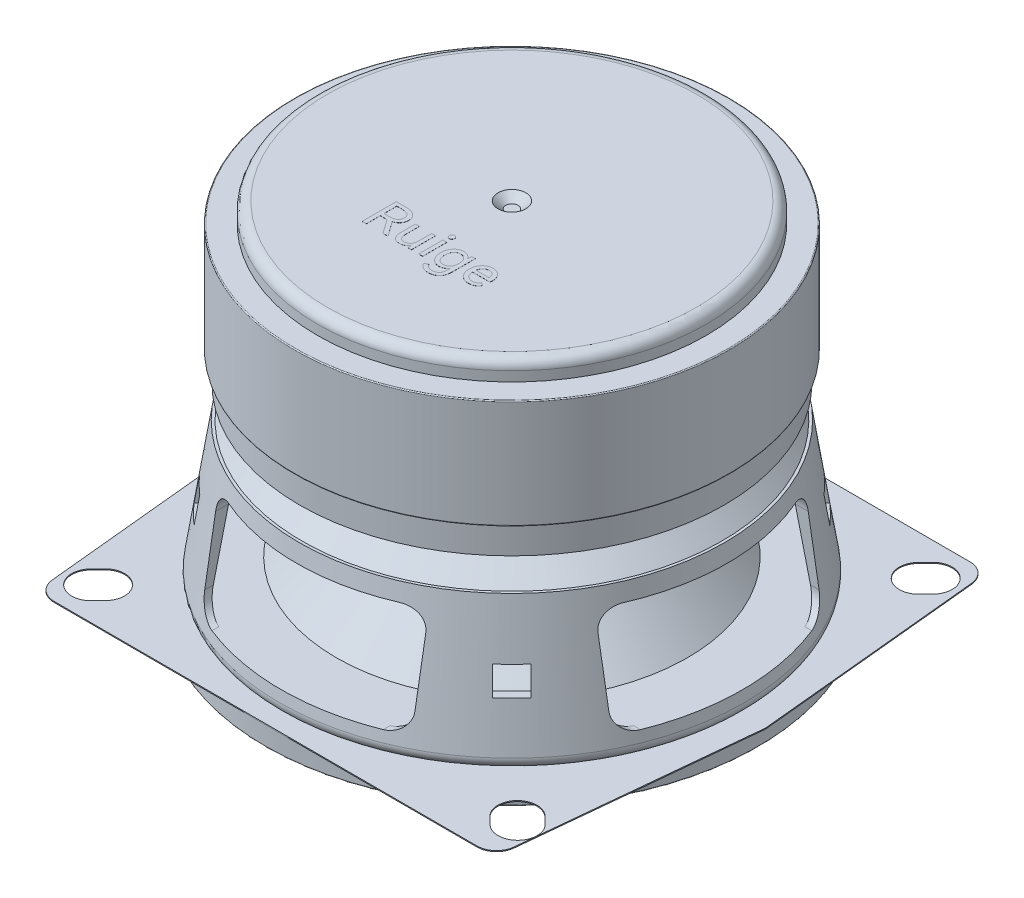
from build123d import *

# Parameters (mm, degrees)
SKETCH_2_R               = 19.925
EXTRUDE_1_DEPTH          = 2
SKETCH_3_R               = 22.3
EXTRUDE_2_DEPTH          = 11.15
SKETCH_4_R               = 21.75
EXTRUDE_3_DEPTH          = 3
SKETCH_5_R               = 18.225
EXTRUDE_4_DEPTH          = 3.3
EXTRUDE_4_DRAFT          = -45
EXTRUDE_5_DEPTH          = 0.1
SKETCH_12_R              = 25.25
EXTRUDE_7_DEPTH          = 2
FILLET_1_R               = 1
FILLET_2_R               = 0.1
FILLET_5_R               = 0.1
CUT_EXTRUDE_3_DEPTH      = 52.024708658
PATTERN_CIRCULAR_1_COUNT = 4
SKETCH_17_R              = 23
CUT_EXTRUDE_4_DEPTH      = 12.125994
CUT_EXTRUDE_4_DRAFT      = 12
EXTRUDE_9_REACH          = 50.081
SKETCH_19_R              = 17.996686734
EXTRUDE_9_DRAFT          = 45
CUT_EXTRUDE_START        = -33.9
CUT_EXTRUDE_5_DEPTH      = 33.9
PATTERN_CIRCULAR_2_COUNT = 4
SKETCH_27_R              = 24.25
CUT_EXTRUDE_6_DEPTH      = 1
SKETCH_28_R              = 17.5
CUT_EXTRUDE_7_DEPTH      = 7
CUT_EXTRUDE_7_DRAFT      = -45
FILLET_6_R               = 0.1
SKETCH_30_W              = 0.406719368
SKETCH_30_H              = 2.481126482
EXTRUDE_11_DEPTH         = 0.01
CUT_EXTRUDE_START_2      = 30
SKETCH_31_W              = 2.706391377
SKETCH_31_H              = 2.784707462
CUT_EXTRUDE_8_DEPTH      = 10
PATTERN_CIRCULAR_3_COUNT = 4
FILLET_7_R               = 1
FILLET_8_R               = 1


# Read off the part's stored shape, not the designer's step: 曲面-缝合2
with BuildPart() as part:
    # 草图2 → 凸台-拉伸1 (new body)
    with BuildSketch(Plane(origin=(0, 0, 0), x_dir=(1, 0, 0), z_dir=(0, 1, 0))):
        with Locations(Location((0, 0, 0), (0, 0, 270))):
            Circle(SKETCH_2_R)
    extrude(amount=-EXTRUDE_1_DEPTH)

    # 草图14 → 切除-旋转1 (revolve, cut)
    with BuildSketch(Plane.XY, mode=Mode.PRIVATE) as cut_revolve_1_sk:
        Polygon((0, 0), (0, -0.717703915), (0.633716951, -0.717703915), (1.426933152, 0), align=None)
    revolve(cut_revolve_1_sk.sketch.rotate(Axis((0, 0, 0), (0, -1, 0)), 270), axis=Axis((0, 0, 0), (0, -1, 0)), mode=Mode.SUBTRACT)

    # 圆角1
    fillet_1_edges = [part.edges().sort_by_distance(p)[0] for p in [
        (0, 0, -19.925),
    ]]
    fillet(fillet_1_edges, radius=FILLET_1_R)

    # 草图30 → 凸台-拉伸11 (add)
    # profile 1 of 6: a face of its own
    with BuildSketch(Plane(origin=(0, 0, 0), x_dir=(1, 0, 0), z_dir=(0, 1, 0))):
        with BuildLine():
            Line((-3.189977143, -9.508206591), (-3.711518645, -9.508206591))
            Line((-3.711518645, -9.508206591), (-4.724858565, -8.073621611))
            Line((-4.724858565, -8.073621611), (-4.767743941, -8.073621611))
            Line((-4.767743941, -8.073621611), (-5.417941569, -8.073621611))
            Line((-5.417941569, -8.073621611), (-5.417941569, -9.508206591))
            Line((-5.417941569, -9.508206591), (-5.844028526, -9.508206591))
            Line((-5.844028526, -9.508206591), (-5.844028526, -6.008206591))
            Line((-5.844028526, -6.008206591), (-4.767743941, -6.008206591))
            add(Edge.make_bspline(
                [(-4.767743941, -6.008206591), (-4.70955201, -6.009767727), (-4.595872808, -6.01281744), (-4.430543422, -6.03754974), (-4.274878485, -6.077294392), (-4.153398813, -6.125045973), (-4.062266763, -6.170555461), (-3.997880606, -6.207743839), (-3.937430612, -6.248811533), (-3.880890416, -6.293018597), (-3.827668416, -6.340105273), (-3.779572492, -6.391437805), (-3.734934017, -6.445717016), (-3.694278018, -6.503045755), (-3.65745215, -6.562864703), (-3.626314425, -6.625824059), (-3.599491507, -6.690508681), (-3.576754117, -6.75735909), (-3.560894465, -6.826554583), (-3.547739113, -6.897537495), (-3.541247241, -6.970932874), (-3.539944619, -7.020614984), (-3.539285443, -7.045755998)],
                knots=[0, 0, 0, 0, 1.934696954, 3.779472598, 5.546483382, 7.268182974, 8.108419679, 8.933114725, 9.739238456, 10.536928548, 11.31898344, 12.100135439, 12.873874383, 13.654800496, 14.436027776, 15.20767373, 15.988110199, 16.764125966, 17.552770483, 18.347062047, 19.163551324, 20, 20, 20, 20], degree=3))
            add(Edge.make_bspline(
                [(-3.539285443, -7.045755998), (-3.539680007, -7.073918297), (-3.540461879, -7.129724973), (-3.550819415, -7.211739879), (-3.565567295, -7.290971813), (-3.587440046, -7.367012503), (-3.614774665, -7.440323822), (-3.649206268, -7.51034914), (-3.688473091, -7.578160438), (-3.735148815, -7.641868893), (-3.785880629, -7.702992655), (-3.842450506, -7.758840629), (-3.902609103, -7.811458631), (-3.96869255, -7.858060435), (-4.038689009, -7.901045982), (-4.113067369, -7.94024851), (-4.192631903, -7.973880145), (-4.247926345, -7.992792934), (-4.275945522, -8.002376551)],
                knots=[0, 0, 0, 0, 1.040008213, 2.060890069, 3.050100258, 4.015617353, 4.980908869, 5.937361294, 6.895936475, 7.87251746, 8.852141338, 9.828127481, 10.806787564, 11.802179348, 12.811907597, 13.84086371, 14.905907697, 16, 16, 16, 16], degree=3))
            Line((-4.275945522, -8.002376551), (-3.189977143, -9.508206591))
        make_face()
        with BuildLine():
            Line((-5.417941569, -6.381724377), (-5.417941569, -7.700795524))
            Line((-5.417941569, -7.700795524), (-4.820313111, -7.700795524))
            add(Edge.make_bspline(
                [(-4.820313111, -7.700795524), (-4.787552491, -7.700299923), (-4.723765511, -7.699334958), (-4.631119158, -7.690854923), (-4.544248608, -7.677578243), (-4.463942606, -7.657119145), (-4.389042171, -7.632663159), (-4.320746178, -7.601218611), (-4.257550365, -7.565533731), (-4.201770653, -7.522914976), (-4.151531445, -7.476507335), (-4.10788884, -7.425948376), (-4.07061385, -7.371585591), (-4.041248766, -7.3131601), (-4.017081975, -7.251737034), (-4.000739626, -7.186414121), (-3.990914775, -7.117300749), (-3.989576217, -7.069998921), (-3.988890186, -7.045755998)],
                knots=[0, 0, 0, 0, 1.314087679, 2.558611031, 3.729626903, 4.835706093, 5.880026302, 6.885990906, 7.847505876, 8.78550528, 9.695301978, 10.587288996, 11.459633258, 12.332565881, 13.205253402, 14.102691954, 15.027600109, 16, 16, 16, 16], degree=3))
            add(Edge.make_bspline(
                [(-3.988890186, -7.045755998), (-3.989604467, -7.021747994), (-3.991011456, -6.974457131), (-4.00060358, -6.905295153), (-4.017389385, -6.839433445), (-4.040870127, -6.777275992), (-4.070847496, -6.71845892), (-4.107802343, -6.663450827), (-4.151757149, -6.612283782), (-4.201459699, -6.564368704), (-4.257761776, -6.521318388), (-4.320459669, -6.483848959), (-4.38919931, -6.452218736), (-4.463643745, -6.425698608), (-4.544288157, -6.405706511), (-4.631148696, -6.39254529), (-4.723724391, -6.382946294), (-4.787545808, -6.382138907), (-4.820313111, -6.381724377)],
                knots=[0, 0, 0, 0, 0.958943898, 1.888923538, 2.782433681, 3.668508104, 4.53761959, 5.413778369, 6.308853537, 7.227314963, 8.166777724, 9.133430475, 10.138837689, 11.184606099, 12.285843585, 13.451733503, 14.691664551, 16, 16, 16, 16], degree=3))
            Line((-4.820313111, -6.381724377), (-5.417941569, -6.381724377))
        make_face(mode=Mode.SUBTRACT)
    # profile 2 of 6: a face of its own
    with BuildSketch(Plane(origin=(0, 0, 0), x_dir=(1, 0, 0), z_dir=(0, 1, 0))):
        with BuildLine():
            Line((-1.206874376, -7.022238211), (-0.800155008, -7.022238211))
            Line((-0.800155008, -7.022238211), (-0.800155008, -9.508206591))
            Line((-0.800155008, -9.508206591), (-1.159147103, -9.508206591))
            add(Edge.make_bspline(
                [(-1.159147103, -9.508206591), (-1.160535092, -9.469228953), (-1.163197642, -9.394458963), (-1.17057106, -9.287745479), (-1.177676871, -9.191058254), (-1.184345526, -9.130292898), (-1.187506787, -9.101487223)],
                knots=[0, 0, 0, 0, 1.147570014, 2.201359651, 3.14735877, 4, 4, 4, 4], degree=3))
            add(Edge.make_bspline(
                [(-1.187506787, -9.101487223), (-1.208964182, -9.138250914), (-1.250988349, -9.210252358), (-1.332739145, -9.303466301), (-1.423276567, -9.384371252), (-1.526195961, -9.448220683), (-1.635817704, -9.499071087), (-1.751739365, -9.533622234), (-1.871778156, -9.557443283), (-1.953790782, -9.559653887), (-1.995411925, -9.560775761)],
                knots=[0, 0, 0, 0, 1.043107617, 2.042919323, 3.029902987, 4.014805639, 5.005420554, 5.988678049, 6.979260601, 8, 8, 8, 8], degree=3))
            add(Edge.make_bspline(
                [(-1.995411925, -9.560775761), (-2.027737465, -9.560033729), (-2.091023814, -9.558580991), (-2.183131491, -9.545624321), (-2.270728891, -9.525978908), (-2.352885692, -9.496654345), (-2.4308401, -9.459824811), (-2.503286935, -9.414017934), (-2.57104211, -9.360260828), (-2.633291694, -9.298645811), (-2.689433109, -9.229456829), (-2.738115434, -9.152835665), (-2.778801239, -9.06912449), (-2.812951683, -8.979206856), (-2.838286227, -8.881943334), (-2.856555896, -8.778312537), (-2.868993811, -8.667629163), (-2.869929609, -8.591510004), (-2.870411925, -8.552277737)],
                knots=[0, 0, 0, 0, 1.02646394, 2.009592267, 2.949556311, 3.87394986, 4.774974462, 5.683442121, 6.59063901, 7.517814613, 8.460486302, 9.41557047, 10.395089971, 11.412760249, 12.466412819, 13.582845246, 14.754184101, 16, 16, 16, 16], degree=3))
            Line((-2.870411925, -8.552277737), (-2.870411925, -7.022238211))
            Line((-2.870411925, -7.022238211), (-2.464384257, -7.022238211))
            Line((-2.464384257, -7.022238211), (-2.464384257, -8.4422975))
            add(Edge.make_bspline(
                [(-2.464384257, -8.4422975), (-2.464070583, -8.470903408), (-2.463459949, -8.526590858), (-2.456312046, -8.607426612), (-2.445332918, -8.683197933), (-2.430429623, -8.754090942), (-2.410211562, -8.819935468), (-2.386226238, -8.880924456), (-2.357759726, -8.936931602), (-2.324526608, -8.9874541), (-2.287222317, -9.032751389), (-2.245423919, -9.071905073), (-2.199185219, -9.104603387), (-2.149331429, -9.131732578), (-2.095120708, -9.152653232), (-2.037129647, -9.16771401), (-1.97472836, -9.176989226), (-1.931809012, -9.177831068), (-1.909641174, -9.178265879)],
                knots=[0, 0, 0, 0, 1.312331565, 2.5547309, 3.72033348, 4.82433299, 5.87524264, 6.877240598, 7.828343218, 8.75270601, 9.646781812, 10.515133921, 11.372393191, 12.238744858, 13.113070833, 14.031785177, 14.983417282, 16, 16, 16, 16], degree=3))
            add(Edge.make_bspline(
                [(-1.909641174, -9.178265879), (-1.879605904, -9.177116785), (-1.820302051, -9.174847929), (-1.732610121, -9.159276715), (-1.648065454, -9.132894533), (-1.566796501, -9.095920359), (-1.489982354, -9.049598298), (-1.420503397, -8.991025527), (-1.359087426, -8.922035777), (-1.304382979, -8.8437073), (-1.260788829, -8.754414729), (-1.228915172, -8.655528901), (-1.210137514, -8.546991764), (-1.207988207, -8.471655205), (-1.206874376, -8.432613705)],
                knots=[0, 0, 0, 0, 0.940580303, 1.857151149, 2.779931299, 3.707502802, 4.647556224, 5.580509548, 6.541874121, 7.533440932, 8.563698858, 9.641625836, 10.777824937, 12, 12, 12, 12], degree=3))
            Line((-1.206874376, -8.432613705), (-1.206874376, -7.022238211))
        make_face()
    # profile 3 of 6: a face of its own
    with BuildSketch(Plane(origin=(0, 0, 0), x_dir=(1, 0, 0), z_dir=(0, 1, 0))):
        with BuildLine():
            add(Edge.make_bspline(
                [(0.157157245, -6.582317263), (0.139300345, -6.581185004), (0.10429795, -6.578965596), (0.053709163, -6.563361081), (0.007893929, -6.535999917), (-0.032799, -6.49960513), (-0.067420285, -6.456848843), (-0.091568274, -6.408806718), (-0.108134342, -6.358133467), (-0.109724725, -6.322831612), (-0.110530502, -6.304945721)],
                knots=[0, 0, 0, 0, 1.004394132, 1.968774074, 2.945640664, 3.984309649, 5.027829232, 6.020083187, 6.996863615, 8, 8, 8, 8], degree=3))
            add(Edge.make_bspline(
                [(-0.110530502, -6.304945721), (-0.109687482, -6.287072613), (-0.108013158, -6.251574784), (-0.091900451, -6.200712944), (-0.067176303, -6.152937112), (-0.032830322, -6.110271323), (0.007901752, -6.07389527), (0.053707163, -6.046529405), (0.104298472, -6.030926096), (0.139300522, -6.028706522), (0.157157245, -6.02757418)],
                knots=[0, 0, 0, 0, 1.003023882, 1.992108573, 2.972734647, 4.016137197, 5.054689694, 6.031446727, 6.995718512, 8, 8, 8, 8], degree=3))
            add(Edge.make_bspline(
                [(0.157157245, -6.02757418), (0.175721416, -6.028377995), (0.211910603, -6.02994496), (0.263775518, -6.046029866), (0.311028347, -6.071961723), (0.351981587, -6.108207898), (0.386298808, -6.150463519), (0.412234129, -6.197820333), (0.427023224, -6.250118395), (0.428786353, -6.28640961), (0.429686889, -6.304945721)],
                knots=[0, 0, 0, 0, 1.027222024, 2.00247727, 2.981500095, 3.997108382, 5.015933681, 5.988837292, 6.972777976, 8, 8, 8, 8], degree=3))
            add(Edge.make_bspline(
                [(0.429686889, -6.304945721), (0.428854783, -6.322819099), (0.427212432, -6.358096258), (0.410964175, -6.409159678), (0.385017816, -6.456910668), (0.349185208, -6.49944668), (0.307801755, -6.536058165), (0.261260931, -6.563369506), (0.210226532, -6.578893648), (0.175010621, -6.581165503), (0.157157245, -6.582317263)],
                knots=[0, 0, 0, 0, 0.995440633, 1.964727503, 2.961416234, 4.013131, 5.053515803, 6.034024399, 7.003311269, 8, 8, 8, 8], degree=3))
        make_face()
    # profile 4 of 6: a face of its own
    with BuildSketch(Plane(origin=(0, 0, 0), x_dir=(1, 0, 0), z_dir=(0, 1, 0))):
        with Locations((0.155082146, -8.26764335)):
            Rectangle(SKETCH_30_W, SKETCH_30_H)
    # profile 5 of 6: a face of its own
    with BuildSketch(Plane(origin=(0, 0, 0), x_dir=(1, 0, 0), z_dir=(0, 1, 0))):
        with BuildLine():
            Line((3.268422067, -7.022238211), (3.268422067, -9.350499081))
            add(Edge.make_bspline(
                [(3.268422067, -9.350499081), (3.267354786, -9.408404324), (3.265292453, -9.520296081), (3.249718177, -9.681582794), (3.222618964, -9.829810498), (3.186396804, -9.965477324), (3.136425587, -10.087257257), (3.078310336, -10.197068857), (3.007541436, -10.293194542), (2.926115541, -10.375282209), (2.837692151, -10.445624394), (2.74524951, -10.506819843), (2.648901362, -10.559140297), (2.548146192, -10.60111376), (2.443705269, -10.634926633), (2.334998134, -10.658092657), (2.222255839, -10.672261397), (2.145835459, -10.674147024), (2.107058431, -10.675103824)],
                knots=[0, 0, 0, 0, 1.387567974, 2.681232473, 3.877697983, 4.995691513, 6.039179059, 7.025636496, 7.966083473, 8.888172103, 9.788194353, 10.669362649, 11.542053707, 12.411239405, 13.281443111, 14.169032291, 15.070935183, 16, 16, 16, 16], degree=3))
            add(Edge.make_bspline(
                [(2.107058431, -10.675103824), (2.076844929, -10.674451271), (2.017033677, -10.673159465), (1.92849899, -10.66654148), (1.842613709, -10.653883207), (1.759412484, -10.636716461), (1.678848688, -10.614339875), (1.600475342, -10.58775687), (1.52513174, -10.554597649), (1.451878862, -10.518590796), (1.383022055, -10.477394388), (1.319642437, -10.431504539), (1.262241573, -10.381520722), (1.209607234, -10.328084707), (1.163551145, -10.269778437), (1.122498495, -10.20819757), (1.087248511, -10.142483933), (1.069048223, -10.096125565), (1.059825229, -10.072633468)],
                knots=[0, 0, 0, 0, 1.126863424, 2.230761376, 3.308088145, 4.362001396, 5.396623865, 6.424435996, 7.445030255, 8.463993448, 9.466684361, 10.433223884, 11.377948486, 12.302143894, 13.22597928, 14.144075382, 15.059510446, 16, 16, 16, 16], degree=3))
            Line((1.059825229, -10.072633468), (1.38976594, -9.885874575))
            add(Edge.make_bspline(
                [(1.38976594, -9.885874575), (1.405969118, -9.918359806), (1.437689687, -9.981955356), (1.50300288, -10.064512096), (1.577002666, -10.136152314), (1.663115346, -10.193733214), (1.760263344, -10.238532956), (1.868020128, -10.269614011), (1.986421448, -10.289675956), (2.068926814, -10.291594602), (2.111900328, -10.292593943)],
                knots=[0, 0, 0, 0, 0.986581066, 1.931405895, 2.851090693, 3.78315513, 4.738672708, 5.754261975, 6.830291184, 8, 8, 8, 8], degree=3))
            add(Edge.make_bspline(
                [(2.111900328, -10.292593943), (2.14028405, -10.291893661), (2.19560816, -10.290528709), (2.276265156, -10.280971604), (2.352092416, -10.264060113), (2.423611086, -10.241858604), (2.489930756, -10.211173203), (2.552549319, -10.175892025), (2.609416925, -10.132024208), (2.662866869, -10.082972693), (2.710676116, -10.024668854), (2.751452634, -9.956001759), (2.785774482, -9.877353758), (2.813961509, -9.789001497), (2.835787148, -9.691062451), (2.851691493, -9.583358053), (2.860206064, -9.465458412), (2.861645294, -9.383482798), (2.862394399, -9.340815286)],
                knots=[0, 0, 0, 0, 0.979769389, 1.909716748, 2.79803167, 3.658858974, 4.488814631, 5.316094608, 6.134289243, 6.962066787, 7.816060114, 8.726491223, 9.709971201, 10.772136686, 11.922898153, 13.170055792, 14.527041492, 16, 16, 16, 16], degree=3))
            Line((2.862394399, -9.340815286), (2.862394399, -9.125696709))
            add(Edge.make_bspline(
                [(2.862394399, -9.125696709), (2.838701987, -9.160819244), (2.792260033, -9.229666566), (2.706815624, -9.31847899), (2.614060527, -9.395035942), (2.511632294, -9.455592985), (2.403518997, -9.502840976), (2.29052607, -9.535953283), (2.173764664, -9.556740228), (2.09446335, -9.559423288), (2.054489261, -9.560775761)],
                knots=[0, 0, 0, 0, 1.058392397, 2.074664658, 3.071289606, 4.059798142, 5.041666933, 6.016526416, 7.000173572, 8, 8, 8, 8], degree=3))
            add(Edge.make_bspline(
                [(2.054489261, -9.560775761), (2.007991961, -9.558932203), (1.915236781, -9.555254579), (1.778508464, -9.524871342), (1.645814737, -9.476153575), (1.540443915, -9.419284884), (1.458954229, -9.365942645), (1.400931849, -9.319785336), (1.345368743, -9.270221421), (1.293532075, -9.215570319), (1.243285965, -9.157793763), (1.197268757, -9.094432399), (1.15355246, -9.027428903), (1.113290346, -8.956167002), (1.077793163, -8.880844805), (1.045309469, -8.802687079), (1.019726951, -8.720727584), (0.996874763, -8.636242059), (0.980958421, -8.547998477), (0.967986706, -8.456690292), (0.961481838, -8.36192293), (0.960185534, -8.29773963), (0.959528786, -8.265222401)],
                knots=[0, 0, 0, 0, 1.474149278, 2.940708008, 4.422156041, 5.947400143, 6.728641115, 7.510224601, 8.297676016, 9.089364625, 9.898805631, 10.725585592, 11.571818849, 12.436665928, 13.320249657, 14.212874383, 15.119865783, 16.042654519, 16.98827688, 17.962972923, 18.967979574, 20, 20, 20, 20], degree=3))
            add(Edge.make_bspline(
                [(0.959528786, -8.265222401), (0.959788422, -8.232694203), (0.960301081, -8.168466054), (0.96852761, -8.073858045), (0.979970475, -7.982146139), (0.99640232, -7.893854912), (1.018163214, -7.808687249), (1.044196461, -7.726577382), (1.075354604, -7.647518215), (1.111418543, -7.572067761), (1.151553054, -7.500466433), (1.194250697, -7.432636308), (1.239918094, -7.369299402), (1.289324524, -7.310937316), (1.342006598, -7.257093507), (1.397268065, -7.206888373), (1.456184872, -7.161986135), (1.538062915, -7.108897913), (1.644366228, -7.053083492), (1.777850894, -7.004776348), (1.915102377, -6.975426953), (2.008006534, -6.971589189), (2.054489261, -6.969669041)],
                knots=[0, 0, 0, 0, 1.029919977, 2.033615691, 3.005539346, 3.956579852, 4.875826833, 5.788085456, 6.683111172, 7.565051714, 8.434661075, 9.281527551, 10.102461249, 10.905663526, 11.700958861, 12.486945865, 13.268373622, 14.044150574, 15.576074162, 17.059124696, 18.528592174, 20, 20, 20, 20], degree=3))
            add(Edge.make_bspline(
                [(2.054489261, -6.969669041), (2.095394751, -6.971185419), (2.176881234, -6.974206144), (2.297154897, -6.996901012), (2.413977495, -7.034742581), (2.526101689, -7.087324483), (2.632733656, -7.153002423), (2.727772139, -7.235671007), (2.812373353, -7.332173048), (2.857860108, -7.40541762), (2.881070288, -7.442791571)],
                knots=[0, 0, 0, 0, 0.982847623, 1.957898417, 2.930615343, 3.927349737, 4.928389034, 5.930471017, 6.943997204, 8, 8, 8, 8], degree=3))
            add(Edge.make_bspline(
                [(2.881070288, -7.442791571), (2.888298071, -7.37021584), (2.902230076, -7.230321567), (2.907557879, -7.089839571), (2.910121672, -7.022238211)],
                knots=[0, 0, 0, 0, 1.037579736, 2, 2, 2, 2], degree=3))
            Line((2.910121672, -7.022238211), (3.268422067, -7.022238211))
        make_face()
        with BuildLine():
            add(Edge.make_bspline(
                [(2.102216533, -9.178265879), (2.127613684, -9.177608588), (2.177931174, -9.176306346), (2.251863169, -9.165732772), (2.323231183, -9.148349434), (2.391655617, -9.123902014), (2.45810483, -9.093654732), (2.520869128, -9.055036916), (2.581726488, -9.010677981), (2.638825996, -8.958852419), (2.692158656, -8.900118232), (2.737688959, -8.832344156), (2.776685895, -8.756941254), (2.808351445, -8.673850016), (2.832324084, -8.582638045), (2.850321139, -8.483940555), (2.860512132, -8.377030849), (2.861753588, -8.303287184), (2.862394399, -8.265222401)],
                knots=[0, 0, 0, 0, 0.90797867, 1.798910791, 2.664880779, 3.530732983, 4.394029247, 5.270806478, 6.161395104, 7.083823891, 8.02403018, 8.991467598, 9.994617027, 11.054327459, 12.164457308, 13.362943767, 14.638812269, 16, 16, 16, 16], degree=3))
            add(Edge.make_bspline(
                [(2.862394399, -8.265222401), (2.861756794, -8.227388732), (2.860525643, -8.154335746), (2.850366409, -8.048559253), (2.832112925, -7.9508513), (2.80852997, -7.860214158), (2.776472625, -7.777516362), (2.737925673, -7.702324257), (2.691917104, -7.635103847), (2.638857887, -7.576408889), (2.581709646, -7.524634864), (2.520904432, -7.480173016), (2.457898955, -7.441856773), (2.391992395, -7.410325137), (2.323053729, -7.387197449), (2.251891713, -7.369477299), (2.177923793, -7.35900017), (2.127611208, -7.357684758), (2.102216533, -7.35702082)],
                knots=[0, 0, 0, 0, 1.357577949, 2.621345624, 3.807657967, 4.921588707, 5.977205676, 6.983789713, 7.947709969, 8.89113536, 9.816722382, 10.710360227, 11.59013939, 12.459901171, 13.325995135, 14.194930053, 15.08891257, 16, 16, 16, 16], degree=3))
            add(Edge.make_bspline(
                [(2.102216533, -7.35702082), (2.075647918, -7.357508775), (2.023844527, -7.358460187), (1.948363168, -7.371043589), (1.876925269, -7.389466235), (1.808915018, -7.4151466), (1.745179905, -7.449029369), (1.686066622, -7.491323172), (1.630313499, -7.539842963), (1.579085285, -7.595881725), (1.533804448, -7.65912928), (1.493008527, -7.727696452), (1.460362869, -7.803087407), (1.432326257, -7.883658778), (1.411021532, -7.970524085), (1.396280249, -8.063544862), (1.386017169, -8.162392453), (1.385294442, -8.230379129), (1.384924043, -8.265222401)],
                knots=[0, 0, 0, 0, 0.976330282, 1.903645273, 2.806789368, 3.687347253, 4.571451925, 5.453927661, 6.355557015, 7.286124665, 8.239602965, 9.212796583, 10.215230919, 11.255974219, 12.348318781, 13.500098107, 14.718796573, 16, 16, 16, 16], degree=3))
            add(Edge.make_bspline(
                [(1.384924043, -8.265222401), (1.385286799, -8.300527263), (1.385992463, -8.369205497), (1.396292246, -8.46896831), (1.410989592, -8.562694229), (1.432499598, -8.650402807), (1.460028776, -8.7318617), (1.493239546, -8.80769351), (1.533580678, -8.876745248), (1.579104026, -8.940094505), (1.630341115, -8.996089744), (1.685844114, -9.044744824), (1.745412738, -9.086154109), (1.808884082, -9.120184337), (1.87693377, -9.145808308), (1.948360812, -9.164246479), (2.023845159, -9.176825609), (2.075648132, -9.177777618), (2.102216533, -9.178265879)],
                knots=[0, 0, 0, 0, 1.293269429, 2.515785494, 3.671563696, 4.767995356, 5.820807847, 6.819464788, 7.796291316, 8.746176699, 9.673237764, 10.571469579, 11.445774316, 12.326547487, 13.203787235, 14.103528084, 15.027348746, 16, 16, 16, 16], degree=3))
        make_face(mode=Mode.SUBTRACT)
    # profile 6 of 6: a face of its own
    with BuildSketch(Plane(origin=(0, 0, 0), x_dir=(1, 0, 0), z_dir=(0, 1, 0))):
        with BuildLine():
            add(Edge.make_bspline(
                [(5.057157245, -6.969669041), (5.083463952, -6.969927049), (5.135272099, -6.970435166), (5.211691089, -6.978668929), (5.28580186, -6.990384515), (5.357728466, -7.005711775), (5.426715988, -7.027624427), (5.493119301, -7.054078862), (5.557665917, -7.084243485), (5.639119692, -7.131254748), (5.733866601, -7.199417606), (5.83530243, -7.295075279), (5.920702659, -7.406192823), (5.992667028, -7.528573633), (6.049293985, -7.661363331), (6.089241125, -7.802230456), (6.114269135, -7.95007108), (6.117347344, -8.051155702), (6.118916138, -8.102672994)],
                knots=[0, 0, 0, 0, 0.724992502, 1.427792431, 2.116564281, 2.793707582, 3.453222815, 4.109605232, 4.763674536, 5.415794485, 6.700237486, 7.972810147, 9.245763864, 10.550886631, 11.878164362, 13.214243565, 14.580252596, 16, 16, 16, 16], degree=3))
            add(Edge.make_bspline(
                [(6.118916138, -8.102672994), (6.118253449, -8.145174641), (6.116981428, -8.226755865), (6.105194704, -8.307481519), (6.099548549, -8.346151255)],
                knots=[0, 0, 0, 0, 1.041946779, 2, 2, 2, 2], degree=3))
            Line((6.099548549, -8.346151255), (4.311505071, -8.346151255))
            add(Edge.make_bspline(
                [(4.311505071, -8.346151255), (4.313989157, -8.380561118), (4.318810579, -8.447348039), (4.334323074, -8.543966798), (4.355229532, -8.633887129), (4.383330184, -8.716799287), (4.416156732, -8.793333309), (4.455768467, -8.862977435), (4.501596554, -8.925768556), (4.553703039, -8.981187485), (4.610748394, -9.029509618), (4.671257437, -9.072149662), (4.735629323, -9.108261789), (4.80376303, -9.137064113), (4.874894235, -9.160485422), (4.950098141, -9.175972106), (5.028763674, -9.185887524), (5.08248904, -9.187255928), (5.109726415, -9.187949674)],
                knots=[0, 0, 0, 0, 1.270402116, 2.465753641, 3.600924155, 4.667274959, 5.686687033, 6.664373866, 7.612350246, 8.543781398, 9.459550565, 10.362067141, 11.267098308, 12.172727158, 13.083321442, 14.021236489, 14.996817948, 16, 16, 16, 16], degree=3))
            add(Edge.make_bspline(
                [(5.109726415, -9.187949674), (5.143212504, -9.186823291), (5.208238596, -9.184635985), (5.302497678, -9.169547218), (5.389513545, -9.143233661), (5.469351277, -9.106465355), (5.541500243, -9.058461801), (5.607181589, -9.000771296), (5.665012837, -8.931764766), (5.69627875, -8.879682867), (5.712196771, -8.853167065)],
                knots=[0, 0, 0, 0, 1.106054763, 2.147829746, 3.142897553, 4.100413216, 5.040442446, 5.995531711, 6.979490264, 8, 8, 8, 8], degree=3))
            Line((5.712196771, -8.853167065), (6.022769893, -9.030242164))
            add(Edge.make_bspline(
                [(6.022769893, -9.030242164), (6.014427837, -9.050955495), (5.997830133, -9.09216761), (5.965681754, -9.150151255), (5.928593044, -9.204747923), (5.886594211, -9.255843112), (5.83909551, -9.303039147), (5.786939906, -9.346959276), (5.729226312, -9.387116131), (5.645697824, -9.435481569), (5.533484165, -9.485646452), (5.391192768, -9.529478101), (5.240942161, -9.55549061), (5.138417876, -9.558992477), (5.086208628, -9.560775761)],
                knots=[0, 0, 0, 0, 0.702046881, 1.396821982, 2.080948413, 2.77666974, 3.474317387, 4.184895915, 4.919473551, 5.683446526, 7.21925995, 8.775092359, 10.35775491, 12, 12, 12, 12], degree=3))
            add(Edge.make_bspline(
                [(5.086208628, -9.560775761), (5.05851871, -9.560516632), (5.003720534, -9.560003819), (4.922717121, -9.551693834), (4.843646459, -9.540332824), (4.766492126, -9.523545349), (4.690957556, -9.502043694), (4.617124018, -9.47601065), (4.545382591, -9.44449558), (4.475907739, -9.408612619), (4.408577753, -9.36898149), (4.345621561, -9.32326653), (4.28507459, -9.274622544), (4.229144399, -9.220198862), (4.17649106, -9.161969276), (4.126932467, -9.099719346), (4.082421061, -9.03202984), (4.039816268, -8.961249946), (4.002505194, -8.885544688), (3.970333077, -8.806136347), (3.942072178, -8.723402804), (3.920620821, -8.63668768), (3.902091884, -8.54658402), (3.889936569, -8.452724753), (3.883136146, -8.355245033), (3.881898865, -8.289211987), (3.881267917, -8.255538607)],
                knots=[0, 0, 0, 0, 0.996902907, 1.972864621, 2.930095546, 3.873244509, 4.814380267, 5.75738296, 6.690865885, 7.63430732, 8.572911313, 9.501653459, 10.434249323, 11.368138535, 12.308907792, 13.26093673, 14.230659485, 15.224825783, 16.235061639, 17.266813331, 18.309437592, 19.381030963, 20.482052878, 21.621372957, 22.787025337, 24, 24, 24, 24], degree=3))
            add(Edge.make_bspline(
                [(3.881267917, -8.255538607), (3.881904192, -8.223018148), (3.883155588, -8.159058405), (3.889920355, -8.064566268), (3.902166116, -7.973254423), (3.920585493, -7.885434643), (3.942217863, -7.800612158), (3.970155835, -7.719611044), (4.002782842, -7.641763231), (4.039980808, -7.567352734), (4.081454903, -7.496543649), (4.127309844, -7.430390643), (4.175725942, -7.367776767), (4.227486368, -7.309503887), (4.28318007, -7.256357268), (4.341475908, -7.206644768), (4.403575736, -7.16195157), (4.46890884, -7.121775362), (4.536375523, -7.085970837), (4.605850865, -7.054586048), (4.677090316, -7.028391937), (4.749871581, -7.006910668), (4.824260362, -6.990104319), (4.900348515, -6.978802661), (4.978118713, -6.970431529), (5.030618807, -6.969925059), (5.057157245, -6.969669041)],
                knots=[0, 0, 0, 0, 1.198513757, 2.357181702, 3.489123074, 4.590582444, 5.662242429, 6.712845736, 7.74486878, 8.770823008, 9.776307263, 10.766161278, 11.734931765, 12.691742357, 13.63517989, 14.569698735, 15.512983212, 16.451472109, 17.39410582, 18.325839438, 19.258657189, 20.188878661, 21.12061228, 22.066342681, 23.022549465, 24, 24, 24, 24], degree=3))
        make_face()
        with BuildLine():
            add(Edge.make_bspline(
                [(5.042631553, -7.342495128), (5.020697386, -7.342995042), (4.977360741, -7.34398275), (4.913558347, -7.35279107), (4.851654779, -7.365626101), (4.79192516, -7.38449157), (4.734374185, -7.408584553), (4.679247832, -7.438879645), (4.626243107, -7.474008202), (4.575410466, -7.514103511), (4.528491943, -7.55986205), (4.485398821, -7.610401572), (4.447210297, -7.666066074), (4.414032199, -7.726710853), (4.384992713, -7.79198137), (4.359916127, -7.862175729), (4.339929161, -7.937403282), (4.330720892, -7.989616382), (4.326030763, -8.016210543)],
                knots=[0, 0, 0, 0, 0.974181983, 1.924749541, 2.857143545, 3.780657673, 4.703546441, 5.625069315, 6.571320365, 7.5265696, 8.497459598, 9.478727416, 10.473382572, 11.491402847, 12.546238478, 13.644799345, 14.800404723, 16, 16, 16, 16], degree=3))
            Line((4.326030763, -8.016210543), (5.678995189, -8.016210543))
            add(Edge.make_bspline(
                [(5.678995189, -8.016210543), (5.677304909, -7.990118808), (5.674016156, -7.939352524), (5.662827549, -7.865818145), (5.646992041, -7.796856237), (5.626160992, -7.732302698), (5.600920238, -7.671727319), (5.569412427, -7.616467762), (5.534008085, -7.565104067), (5.493095269, -7.5189771), (5.448266238, -7.477632923), (5.400239404, -7.441204507), (5.348714326, -7.410627354), (5.293743023, -7.38560689), (5.235502417, -7.366317298), (5.174123662, -7.35246176), (5.109502498, -7.34399358), (5.06525327, -7.343002038), (5.042631553, -7.342495128)],
                knots=[0, 0, 0, 0, 1.206755296, 2.347965007, 3.429941462, 4.470212713, 5.476652564, 6.453783143, 7.401774207, 8.352153161, 9.293847203, 10.213624225, 11.130130315, 12.054332322, 12.996928514, 13.95762573, 14.95586853, 16, 16, 16, 16], degree=3))
        make_face(mode=Mode.SUBTRACT)
    extrude(amount=EXTRUDE_11_DEPTH)


with BuildPart() as body_2:
    # 草图3 → 凸台-拉伸2 (new body)
    with BuildSketch(Plane.XZ.offset(2)):
        with Locations(Location((0, 0, 0), (0, 0, 270))):
            Circle(SKETCH_3_R)
    extrude(amount=EXTRUDE_2_DEPTH)

    # 草图4 → 凸台-拉伸3 (add)
    with BuildSketch(Plane.XZ.offset(13.15)):
        with Locations(Location((0, 0, 0), (0, 0, 270))):
            Circle(SKETCH_4_R)
    extrude(amount=EXTRUDE_3_DEPTH)


with BuildPart() as extrude_4_tool:
    # 草图5 → 凸台-拉伸4 (with draft: the straight prism first)
    with BuildSketch(Plane(origin=(0, -16.15, 0), x_dir=(-1, 0, 0), z_dir=(0, -1, 0))):
        Circle(SKETCH_5_R)
    extrude(amount=EXTRUDE_4_DEPTH)
    # 凸台-拉伸4: the draft: its side faces are tilted about the plane it starts from
    extrude_4_sides = [extrude_4_tool.faces().sort_by_distance(p)[0] for p in [
        (18.225, -17.8, 0),
    ]]
    draft(extrude_4_sides, Plane(origin=(0, -16.15, 0), x_dir=(-1, 0, 0), z_dir=(0, -1, 0)), EXTRUDE_4_DRAFT)


with BuildPart() as body_2_1:
    add(body_2.part)

    # 凸台-拉伸4: add extrude_4_tool
    add(extrude_4_tool.part)

    # 圆角2
    fillet_2_edges = [body_2_1.edges().sort_by_distance(p)[0] for p in [
        (0, -2, 22.3),
    ]]
    fillet(fillet_2_edges, radius=FILLET_2_R)

    # 圆角5
    fillet_5_edges = [body_2_1.edges().sort_by_distance(p)[0] for p in [
        (0, -13.15, 22.3),
    ]]
    fillet(fillet_5_edges, radius=FILLET_5_R)




with BuildPart() as body_3:
    # 草图11 → 凸台-拉伸5 (new body)
    with BuildSketch(Plane(origin=(0, -33.8, 0), x_dir=(-1, 0, 0), z_dir=(0, -1, 0))):
        with BuildLine():
            Line((21.701900765, 25.270442889), (-21.732521866, 25.229550663))
            ThreePointArc((-21.732521866, 25.229550663), (-23.075039501, 24.710290247), (-23.721162686, 23.424012746))
            Line((-23.721162686, 23.424012746), (-25.99274607, 0.171863813))
            ThreePointArc((-25.99274607, 0.171863813), (-26.002221422, -0.024480323), (-25.992376382, -0.22080627))
            Line((-25.992376382, -0.22080627), (-23.677014642, -23.46863673))
            ThreePointArc((-23.677014642, -23.46863673), (-23.02847062, -24.75369534), (-21.684977628, -25.270426956))
            Line((-21.684977628, -25.270426956), (21.715598729, -25.229566596))
            ThreePointArc((21.715598729, -25.229566596), (23.053092165, -24.712586756), (23.697585946, -23.431655605))
            Line((23.697585946, -23.431655605), (25.988125154, -0.196207972))
            ThreePointArc((25.988125154, -0.196207972), (25.997772815, 0), (25.988125154, 0.196207972))
            Line((25.988125154, 0.196207972), (23.694136044, 23.466651748))
            ThreePointArc((23.694136044, 23.466651748), (23.046139193, 24.753036687), (21.701900765, 25.270442889))
        make_face()
    extrude(amount=EXTRUDE_5_DEPTH)

    # 草图12 → 凸台-拉伸7 (add)
    with BuildSketch(Plane.XZ.offset(33.9)):
        with Locations(Location((0, 0, 0), (0, 0, 90.053942268))):
            Circle(SKETCH_12_R)
    extrude(amount=EXTRUDE_7_DEPTH)

    # 草图20 → 切除-拉伸5 (cut)
    with BuildSketch(Plane.XZ.offset(35.9).offset(CUT_EXTRUDE_START)):
        with BuildLine():
            Line((19.746834936, 22.007101354), (20.463501603, 22.704517219))
            ThreePointArc((20.463501603, 22.704517219), (23.291666667, 22.666015616), (23.253165064, 19.837850552))
            Line((23.253165064, 19.837850552), (22.536498397, 19.140434687))
            ThreePointArc((22.536498397, 19.140434687), (19.708333333, 19.17893629), (19.746834936, 22.007101354))
        make_face()
    cut_extrude_5 = extrude(amount=CUT_EXTRUDE_5_DEPTH, mode=Mode.SUBTRACT)

    # 阵列(圆周)2: 切除-拉伸5 ×4 about axis
    pattern_circular_2_axis = Axis((0, 0, 0), (0, 1, 0))
    for i in range(1, PATTERN_CIRCULAR_2_COUNT):
        add(cut_extrude_5.rotate(pattern_circular_2_axis, i * 360 / PATTERN_CIRCULAR_2_COUNT), mode=Mode.SUBTRACT)

    # 草图27 → 切除-拉伸6 (cut)
    with BuildSketch(Plane.XZ.offset(35.9)):
        with Locations(Location((0, 0, 0), (0, 0, 270))):
            Circle(SKETCH_27_R)
    extrude(amount=-CUT_EXTRUDE_6_DEPTH, mode=Mode.SUBTRACT)


with BuildPart() as body_4:
    # Knit 2 outline → Knit 2 (revolve)
    with BuildSketch(Plane.XY):
        Polygon((21.8, -19.45), (0, -19.45), (0, -33.8), (24, -33.8), align=None)
    revolve(axis=Axis((0, 0, 0), (0, 1, 0)))

    # 草图15 → 切除-拉伸3 (cut, symmetric)
    with BuildSketch(Plane.XY):
        with BuildLine():
            Line((-8.776386593, -21.162420253), (8.776386593, -21.162420253))
            ThreePointArc((8.776386593, -21.162420253), (10.190600155, -21.748206691), (10.776386593, -23.162420253))
            Line((10.776386593, -23.162420253), (10.776386593, -29.575994124))
            ThreePointArc((10.776386593, -29.575994124), (10.190600155, -30.990207686), (8.776386593, -31.575994124))
            Line((8.776386593, -31.575994124), (-8.776386593, -31.575994124))
            ThreePointArc((-8.776386593, -31.575994124), (-10.190600155, -30.990207686), (-10.776386593, -29.575994124))
            Line((-10.776386593, -29.575994124), (-10.776386593, -23.162420253))
            ThreePointArc((-10.776386593, -23.162420253), (-10.190600155, -21.748206691), (-8.776386593, -21.162420253))
        make_face()
    cut_extrude_3 = extrude(amount=CUT_EXTRUDE_3_DEPTH, both=True, mode=Mode.SUBTRACT)

    # 阵列(圆周)1: 切除-拉伸3 ×4 about axis
    pattern_circular_1_axis = Axis((0, -19.45, 0), (0, -1, 0))
    for i in range(1, PATTERN_CIRCULAR_1_COUNT):
        add(cut_extrude_3.rotate(pattern_circular_1_axis, i * 360 / PATTERN_CIRCULAR_1_COUNT), mode=Mode.SUBTRACT)


with BuildPart() as cut_extrude_4_tool:
    # 草图17 → 切除-拉伸4 (with draft: the straight prism first)
    with BuildSketch(Plane(origin=(0, -31.575994124, 0), x_dir=(1, 0, 0), z_dir=(0, 1, 0))):
        Circle(SKETCH_17_R)
    extrude(amount=CUT_EXTRUDE_4_DEPTH)
    # 切除-拉伸4: the draft: its side faces are tilted about the plane it starts from
    cut_extrude_4_sides = [cut_extrude_4_tool.faces().sort_by_distance(p)[0] for p in [
        (-23, -25.512997124, 0),
    ]]
    draft(cut_extrude_4_sides, Plane(origin=(0, -31.575994124, 0), x_dir=(1, 0, 0), z_dir=(0, 1, 0)), CUT_EXTRUDE_4_DRAFT)


with BuildPart() as body_4_1:
    add(body_4.part)

    # 切除-拉伸4: cut by cut_extrude_4_tool
    add(cut_extrude_4_tool.part, mode=Mode.SUBTRACT)


with BuildPart() as extrude_9_long_prism_1:
    # 草图19 → 凸台-拉伸9 (the long prism of profile 1, to be tilted and cut off)
    with BuildSketch(Plane(origin=(0, -31.575994124, 0), x_dir=(1, 0, 0), z_dir=(0, 1, 0))):
        Circle(SKETCH_19_R)
    extrude(amount=EXTRUDE_9_REACH)
    extrude_9_tool1_sides = [extrude_9_long_prism_1.faces().sort_by_distance(p)[0] for p in [
        (-17.996686734, -6.535494124, 0),
    ]]
    draft(extrude_9_tool1_sides, Plane(origin=(0, -31.575994124, 0), x_dir=(1, 0, 0), z_dir=(0, 1, 0)), EXTRUDE_9_DRAFT)  # the draft: side faces tilted about the start plane


with BuildPart() as body_2_2:
    add(body_2_1.part)
    extrude_9_tool1 = extrude_9_long_prism_1.part - body_2_1.part

    add(body_4_1.part)  # 凸台-拉伸9 merges body 4
    add(extrude_9_tool1.solids().sort_by_distance((0, -31.575994, 0))[0])


with BuildPart() as cut_extrude_7_tool:
    # 草图28 → 切除-拉伸7 (with draft: the straight prism first)
    with BuildSketch(Plane.XZ.offset(34.9)):
        Circle(SKETCH_28_R)
    extrude(amount=-CUT_EXTRUDE_7_DEPTH)
    # 切除-拉伸7: the draft: its side faces are tilted about the plane it starts from
    cut_extrude_7_sides = [cut_extrude_7_tool.faces().sort_by_distance(p)[0] for p in [
        (-17.5, -31.4, 0),
    ]]
    draft(cut_extrude_7_sides, Plane.XZ.offset(34.9), CUT_EXTRUDE_7_DRAFT)


with BuildPart() as body_2_3:
    add(body_2_2.part)

    # 切除-拉伸7: cut by cut_extrude_7_tool
    add(cut_extrude_7_tool.part, mode=Mode.SUBTRACT)

    # 草图29 → 旋转2 (revolve)
    with BuildSketch(Plane(origin=(0, 0, 0), x_dir=(0, 0, -1), z_dir=(1, 0, 0))):
        with BuildLine():
            Line((0.13557761, -20.403509327), (0.204660489, -30.800013355))
            ThreePointArc((0.204660489, -30.800013355), (5.368371063, -25.567219902), (0.13557761, -20.403509327))
        make_face()
    revolve(axis=Axis((0, -20.403509327, -0.13557761), (0, -0.9999779239267406, -0.0066446714866841726)))

    # 草图31 → 切除-拉伸8 (cut, symmetric)
    with BuildSketch(Plane(origin=(0, 0, 0), x_dir=(0, 1, 0), z_dir=(0.7071067811865464, 0, -0.7071067811865488)).offset(CUT_EXTRUDE_START_2)):
        with Locations((-26.482923107, 0)):
            Rectangle(SKETCH_31_W, SKETCH_31_H)
    cut_extrude_8 = extrude(amount=CUT_EXTRUDE_8_DEPTH, both=True, mode=Mode.SUBTRACT)

    # 阵列(圆周)3: 切除-拉伸8 ×4 about axis
    pattern_circular_3_axis = Axis((0, 0, 0), (0, 1, 0))
    for i in range(1, PATTERN_CIRCULAR_3_COUNT):
        add(cut_extrude_8.rotate(pattern_circular_3_axis, i * 360 / PATTERN_CIRCULAR_3_COUNT), mode=Mode.SUBTRACT)

    # 圆角7
    fillet_7_edges = [body_2_3.edges().sort_by_distance(p)[0] for p in [
        (-10.5, -27.9, 0),
        (-16.4, -33.8, 0),
        (0, -27.9, 4.492617934),
    ]]
    fillet(fillet_7_edges, radius=FILLET_7_R)

    # 圆角8
    fillet_8_edges = [body_2_3.edges().sort_by_distance(p)[0] for p in [
        (-24, -33.8, 0),
    ]]
    fillet(fillet_8_edges, radius=FILLET_8_R)


with BuildPart() as body_3_1:
    add(body_3.part)

    # 切除-拉伸7: cut by cut_extrude_7_tool
    add(cut_extrude_7_tool.part, mode=Mode.SUBTRACT)

    # 圆角6
    fillet_6_edges = [body_3_1.edges().sort_by_distance(p)[0] for p in [
        (0.023772119, -35.9, -25.24998881),
        (0, -35.9, 24.25),
        (-16.4, -33.8, 0),
        (-17.5, -34.9, 0),
    ]]
    fillet(fillet_6_edges, radius=FILLET_6_R)


solid = Compound([part.part, body_2_3.part, body_3_1.part])
